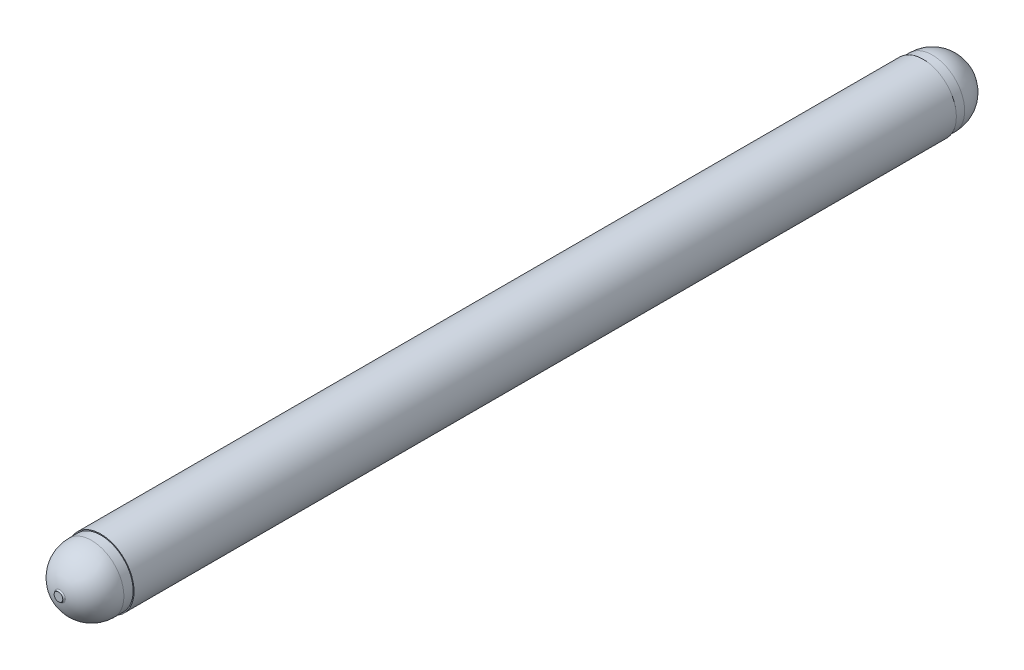
from build123d import *
from OCP.BRepAlgoAPI import BRepAlgoAPI_Cut
from OCP.TopTools import TopTools_ListOfShape

# Parameters (mm, degrees)
BOSS_EXTRUDE1_DEPTH      = 1885.953741
BOSS_EXTRUDE1_DEPTH_BACK = 82.476716
SKETCH1_R                = 72


with BuildPart() as part:
    # Sketch1 → Boss-Extrude1 (new, two sides: drawn at the far end of the back side and taken through both)
    with BuildSketch(Plane.XY.offset(-BOSS_EXTRUDE1_DEPTH_BACK)):
        with Locations(Location((0, 0, 0), (0, 0, 270))):
            Circle(SKETCH1_R)
    extrude(amount=BOSS_EXTRUDE1_DEPTH + BOSS_EXTRUDE1_DEPTH_BACK)


with BuildPart() as cavity3_tool:
    # Cavity3: read off the stored shape, not the designer's step
    # Cavity3 outline → Cavity3 (revolve)
    with BuildSketch(Plane.XZ):
        with BuildLine():
            Line((72, -82.476716089), (72, 10))
            Line((72, 10), (70, 10))
            Line((70, 10), (70, -9.999999977))
            ThreePointArc((70, -9.999999977), (52.371990052, -56.445394367), (8.366438321, -79.498220911))
            ThreePointArc((8.366438321, -79.498220911), (6.48048614, -80.486199187), (5.725, -82.476716089))
            Line((5.725, -82.476716089), (72, -82.476716089))
        make_face()
        with BuildLine():
            Line((70, 1813.99999993), (70, 1794))
            Line((70, 1794), (72, 1794))
            Line((72, 1794), (72, 1885.953740521))
            Line((72, 1885.953740521), (9.315, 1885.953740521))
            ThreePointArc((9.315, 1885.953740521), (10.021717672, 1884.019611217), (11.80890411, 1882.996737486))
            ThreePointArc((11.80890411, 1882.996737486), (53.509920985, 1859.129683759), (70, 1813.99999993))
        make_face()
    revolve(axis=Axis((0, 0, 0), (0, 0, 1)))


with BuildPart() as part_1:
    add(part.part)

    # Cavity3: cut by cavity3_tool, with a tolerance
    cavity3_stock = TopTools_ListOfShape()
    cavity3_stock.Append(part_1.part.wrapped)
    cavity3_tools = TopTools_ListOfShape()
    cavity3_tools.Append(cavity3_tool.part.wrapped)
    cavity3_cut = BRepAlgoAPI_Cut()
    cavity3_cut.SetArguments(cavity3_stock)
    cavity3_cut.SetTools(cavity3_tools)
    cavity3_cut.SetFuzzyValue(0.00001)
    cavity3_cut.Build()
    add(Compound.cast(cavity3_cut.Shape()).solids(), mode=Mode.REPLACE)


solid = part_1.part
